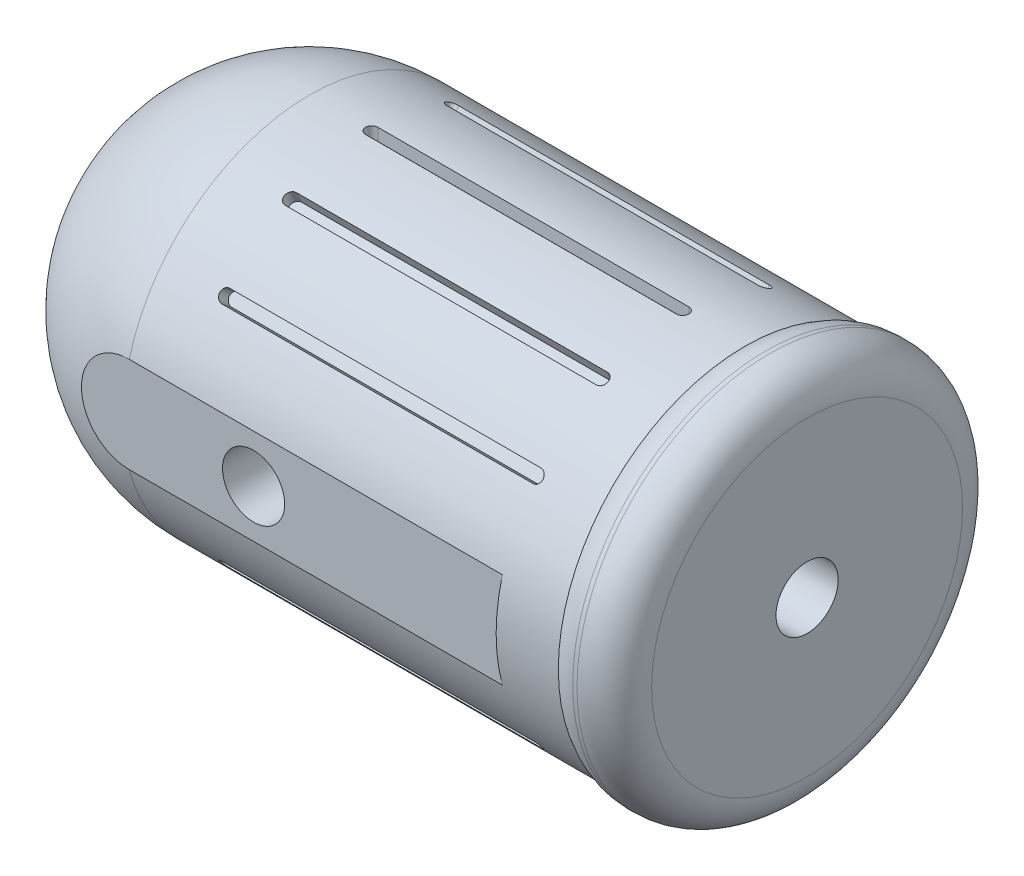
from build123d import *
from OCP.BRepFilletAPI import BRepFilletAPI_MakeFillet

# Parameters (mm, degrees)
FILLET1_R          = 3
SKETCH3_R          = 2.5
CUT_EXTRUDE1_DEPTH = 5
CUT_EXTRUDE4_START = 15
SKETCH4_R          = 2.5
CUT_EXTRUDE4_DEPTH = 5
CUT_EXTRUDE5_START = 15
CUT_EXTRUDE5_DEPTH = 1
CIRPATTERN1_COUNT  = 14
SKETCH7_W          = 40
SKETCH7_H          = 5
CUT_EXTRUDE6_DEPTH = 46.612498355
CUT_EXTRUDE7_START = -15
SKETCH8_R          = 5
SKETCH8_R_2        = 3
CUT_EXTRUDE7_DEPTH = 10
FILLET2_R1         = 1
FILLET2_R2         = 2


with BuildPart() as part:
    # Sketch2 → Revolve1 (revolve)
    with BuildSketch(Plane.XY, mode=Mode.PRIVATE) as revolve1_sk:
        with BuildLine():
            Line((0, 15), (35, 15))
            Line((35, 15), (35, 15.5))
            Line((35, 15.5), (40, 15.5))
            Line((40, 15.5), (40, 0))
            Line((40, 0), (-15, 0))
            ThreePointArc((-15, 0), (-10.606601718, 10.606601718), (0, 15))
        make_face()
    revolve(revolve1_sk.sketch.rotate(Axis((-15, 0, 0), (1, 0, 0)), 90), axis=Axis((-15, 0, 0), (1, 0, 0)))

    # Fillet1
    # the kernel refuses this fillet: 3 mm, written as the material it takes off along each edge
    with BuildSketch(Plane(origin=(35, 0, 0), x_dir=(0, 0, 1), z_dir=(0, 1, 0))) as fillet1_piece_1:
        with BuildLine():
            CenterArc((12.5, 1.658312395), FILLET1_R, 326.442690238, 33.557309762)
            Line((15.5, 1.658312395), (15.56, 1.658312395))
            Line((15.56, 1.658312395), (15.56, 0))
            Line((15.56, 0), (15.5, -0.06))
            ThreePointArc((15.5, -0.06), (15.25, -0.06), (15.05, -0.033166248))
            Line((15.05, -0.033166248), (15, 0))
        make_face()
    revolve(axis=Axis((35, 0, 0), (1, 0, 0)), mode=Mode.SUBTRACT)
    with BuildSketch(Plane(origin=(40, 0, 0), x_dir=(0, 0, 1), z_dir=(0, 1, 0))) as fillet1_piece_2:
        with BuildLine():
            CenterArc((15.5 - FILLET1_R, -FILLET1_R), FILLET1_R, 0, 90)
            Line((15.5 - FILLET1_R, 0), (15.5 - FILLET1_R, FILLET1_R * 0.02))
            Line((15.5 - FILLET1_R, FILLET1_R * 0.02), (15.5 + FILLET1_R * 0.02, FILLET1_R * 0.02))
            Line((15.5 + FILLET1_R * 0.02, FILLET1_R * 0.02), (15.5 + FILLET1_R * 0.02, -FILLET1_R))
            Line((15.5 + FILLET1_R * 0.02, -FILLET1_R), (15.5, -FILLET1_R))
        make_face()
    revolve(axis=Axis((40, 0, 0), (1, 0, 0)), mode=Mode.SUBTRACT)

    # Sketch3 → Cut-Extrude1 (cut)
    with BuildSketch(Plane(origin=(40, 0, 0), x_dir=(0, 0, -1), z_dir=(1, 0, 0))):
        Circle(SKETCH3_R)
    extrude(amount=-CUT_EXTRUDE1_DEPTH, mode=Mode.SUBTRACT)

    # Sketch4 → Cut-Extrude4 (cut)
    with BuildSketch(Plane.XY.offset(CUT_EXTRUDE4_START)):
        with Locations((10, 0)):
            Circle(SKETCH4_R)
    cut_extrude4 = extrude(amount=-CUT_EXTRUDE4_DEPTH, mode=Mode.SUBTRACT)

    # Mirror1: Cut-Extrude4 across plane
    add(cut_extrude4.mirror(Plane.XY), mode=Mode.SUBTRACT)

    # Sketch6 → Cut-Extrude5 (cut)
    with BuildSketch(Plane(origin=(0, 0, 0), x_dir=(1, 0, 0), z_dir=(0, 1, 0)).offset(CUT_EXTRUDE5_START)):
        with BuildLine():
            Line((30, -0.5), (5, -0.5))
            ThreePointArc((5, -0.5), (4.5, 0), (5, 0.5))
            Line((5, 0.5), (30, 0.5))
            ThreePointArc((30, 0.5), (30.5, 0), (30, -0.5))
        make_face()
    cut_extrude5 = extrude(amount=-CUT_EXTRUDE5_DEPTH, mode=Mode.SUBTRACT)

    # CirPattern1: Cut-Extrude5 ×14 about axis, 4 skipped
    cirpattern1_axis = Axis((0, 0, 0), (-1, 0, 0))
    add([cut_extrude5.rotate(cirpattern1_axis, i * 360 / CIRPATTERN1_COUNT) for i in range(1, CIRPATTERN1_COUNT) if i not in (3, 4, 10, 11)], mode=Mode.SUBTRACT)

    # Sketch7 → Cut-Extrude6 (cut, symmetric)
    with BuildSketch(Plane(origin=(0, 0, 0), x_dir=(1, 0, 0), z_dir=(0, 1, 0))):
        with Locations((10, 17)):
            Rectangle(SKETCH7_W, SKETCH7_H)
    cut_extrude6 = extrude(amount=CUT_EXTRUDE6_DEPTH, both=True, mode=Mode.SUBTRACT)

    # Mirror2: Cut-Extrude6 across plane
    add(cut_extrude6.mirror(Plane.XY), mode=Mode.SUBTRACT)

    # Sketch8 → Cut-Extrude7 (cut)
    with BuildSketch(Plane(origin=(0, 0, 0), x_dir=(0, 0, -1), z_dir=(1, 0, 0)).offset(CUT_EXTRUDE7_START)):
        Circle(SKETCH8_R)
        Circle(SKETCH8_R_2, mode=Mode.SUBTRACT)
    extrude(amount=CUT_EXTRUDE7_DEPTH, mode=Mode.SUBTRACT)

    # Fillet2: one fillet with a radius per group of edges: ONE call of the kernel's fillet builder (fillet() takes one radius for all edges)
    fillet2_edges_1 = [part.edges().sort_by_distance(p)[0] for p in [
        (-14.696938457, -3, 0),
    ]]
    fillet2_edges_2 = [part.edges().sort_by_distance(p)[0] for p in [
        (-14.142135624, 5, 0),
    ]]
    fillet2 = BRepFilletAPI_MakeFillet(part.part.solid().wrapped)
    for e in fillet2_edges_1:
        fillet2.Add(FILLET2_R1, e.wrapped)
    for e in fillet2_edges_2:
        fillet2.Add(FILLET2_R2, e.wrapped)
    add(Compound.cast(fillet2.Shape()), mode=Mode.REPLACE)


solid = part.part
